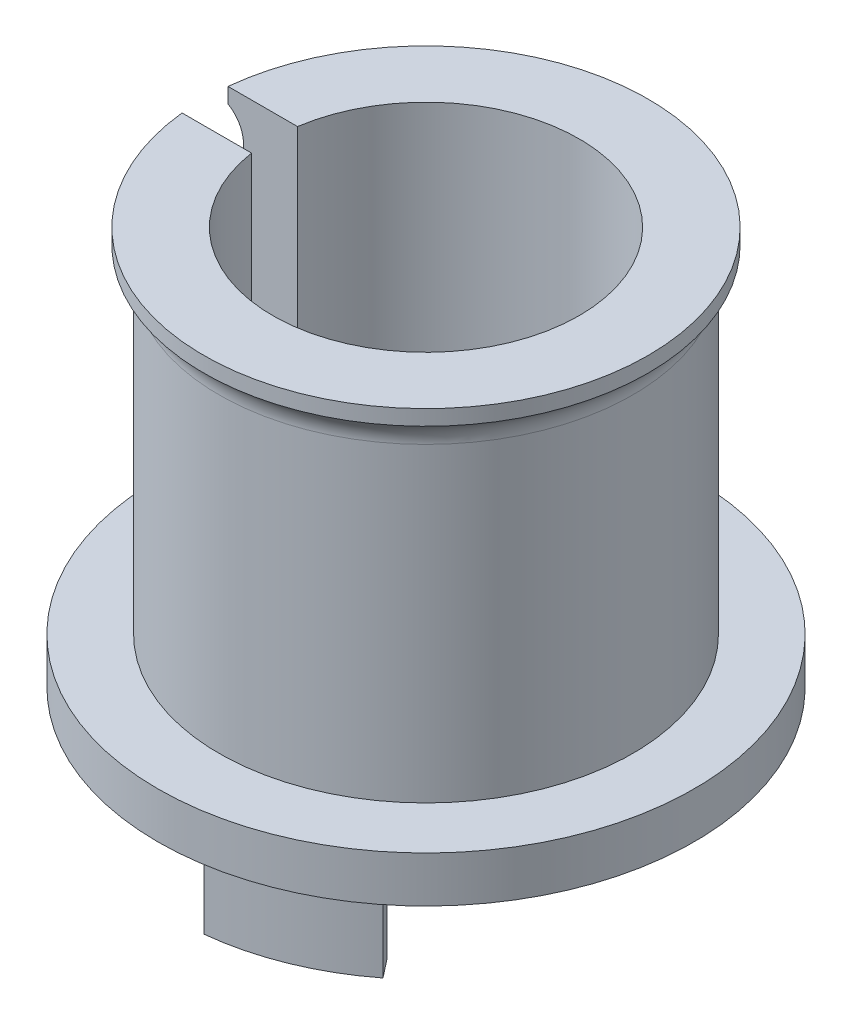
from build123d import *

# Parameters (mm, degrees)
SKETCH2_R           = 13.5
SKETCH2_R_2         = 10
BOSS_EXTRUDE1_DEPTH = 22
SKETCH2_4_R         = 17.5
SKETCH2_4_R_2       = 13.5
SKETCH2_4_R_3       = 10
BOSS_EXTRUDE2_DEPTH = 3
BOSS_EXTRUDE3_DEPTH = 5
SKETCH4_R           = 14.5
SKETCH4_R_2         = 10
BOSS_EXTRUDE4_DEPTH = 1
FILLET1_R           = 2
CUT_EXTRUDE1_START  = -31
CUT_EXTRUDE1_DEPTH  = 31


with BuildPart() as part:
    # Sketch2 → Boss-Extrude1 (new body)
    with BuildSketch(Plane(origin=(0, 0, 0), x_dir=(1, 0, 0), z_dir=(0, 1, 0))):
        with Locations(Location((0, 0, 0), (0, 0, 270))):
            Circle(SKETCH2_R)
        with Locations(Location((0, 0, 0), (0, 0, 270))):
            Circle(SKETCH2_R_2, mode=Mode.SUBTRACT)
    extrude(amount=BOSS_EXTRUDE1_DEPTH)

    # Sketch4 → Boss-Extrude4 (add)
    with BuildSketch(Plane(origin=(0, 22, 0), x_dir=(1, 0, 0), z_dir=(0, 1, 0))):
        with Locations(Location((0, 0, 0), (0, 0, 270))):
            Circle(SKETCH4_R)
        with Locations(Location((0, 0, 0), (0, 0, 270))):
            Circle(SKETCH4_R_2, mode=Mode.SUBTRACT)
    extrude(amount=BOSS_EXTRUDE4_DEPTH)

    # Fillet1
    # the kernel refuses this fillet: 2 mm, written as the material it adds along each edge
    with BuildSketch(Plane(origin=(0, 22, 0), x_dir=(0, 0, 1), z_dir=(-1, 0, 0))) as fillet1_piece_1:
        with BuildLine():
            CenterArc((15.5, -1.732050808), FILLET1_R, 120, 60)
            Line((14.5, 0), (14.48, 0.034641016))
            ThreePointArc((14.48, 0.034641016), (14, 0.04), (13.5, 0.04))
            Line((13.5, 0.04), (13.46, 0))
            Line((13.46, 0), (13.46, -1.732050808))
            Line((13.46, -1.732050808), (13.5, -1.732050808))
        make_face()
    revolve(axis=Axis((0, 22, 0), (0, 1, 0)))

    # Sketch5 → Cut-Extrude1 (cut)
    with BuildSketch(Plane(origin=(0, 23, 0), x_dir=(1, 0, 0), z_dir=(0, 1, 0)).offset(CUT_EXTRUDE1_START)):
        with BuildLine():
            Line((-9.886859967, 1.5), (-14.422205102, 1.5))
            ThreePointArc((-14.422205102, 1.5), (-14.5, 0), (-14.422205102, -1.5))
            Line((-14.422205102, -1.5), (-9.886859967, -1.5))
            ThreePointArc((-9.886859967, -1.5), (-10, 0), (-9.886859967, 1.5))
        make_face()
    extrude(amount=CUT_EXTRUDE1_DEPTH, mode=Mode.SUBTRACT)


with BuildPart() as body_2:
    # Sketch2<4> → Boss-Extrude2 (new body)
    # profile 1 of 2: a face of its own
    with BuildSketch(Plane(origin=(0, 0, 0), x_dir=(1, 0, 0), z_dir=(0, 1, 0))):
        with Locations(Location((0, 0, 0), (0, 0, 270))):
            Circle(SKETCH2_4_R)
        with Locations(Location((0, 0, 0), (0, 0, 270))):
            Circle(SKETCH2_4_R_2, mode=Mode.SUBTRACT)
    # profile 2 of 2: a face of its own
    with BuildSketch(Plane(origin=(0, 0, 0), x_dir=(1, 0, 0), z_dir=(0, 1, 0))):
        with Locations(Location((0, 0, 0), (0, 0, 270))):
            Circle(SKETCH2_4_R_2)
        with Locations(Location((0, 0, 0), (0, 0, 270))):
            Circle(SKETCH2_4_R_3, mode=Mode.SUBTRACT)
    extrude(amount=-BOSS_EXTRUDE2_DEPTH)

    # Sketch3 → Boss-Extrude3 (add)
    with BuildSketch(Plane.XZ.offset(3)):
        with BuildLine():
            Line((9.111789835, 11.662559153), (10.035282048, 12.844575284))
            ThreePointArc((10.035282048, 12.844575284), (6.106087473, 15.113096829), (1.703813951, 16.210706895))
            Line((1.703813951, 16.210706895), (1.547021256, 14.718924051))
            ThreePointArc((1.547021256, 14.718924051), (5.544177583, 13.722321048), (9.111789835, 11.662559153))
        make_face()
        with BuildLine():
            Line((1.547021256, -14.718924051), (1.703813951, -16.210706895))
            ThreePointArc((1.703813951, -16.210706895), (6.106087473, -15.113096829), (10.035282048, -12.844575284))
            Line((10.035282048, -12.844575284), (9.111789835, -11.662559153))
            ThreePointArc((9.111789835, -11.662559153), (5.544177583, -13.722321048), (1.547021256, -14.718924051))
        make_face()
    extrude(amount=BOSS_EXTRUDE3_DEPTH)


solid = Compound([part.part, body_2.part])
